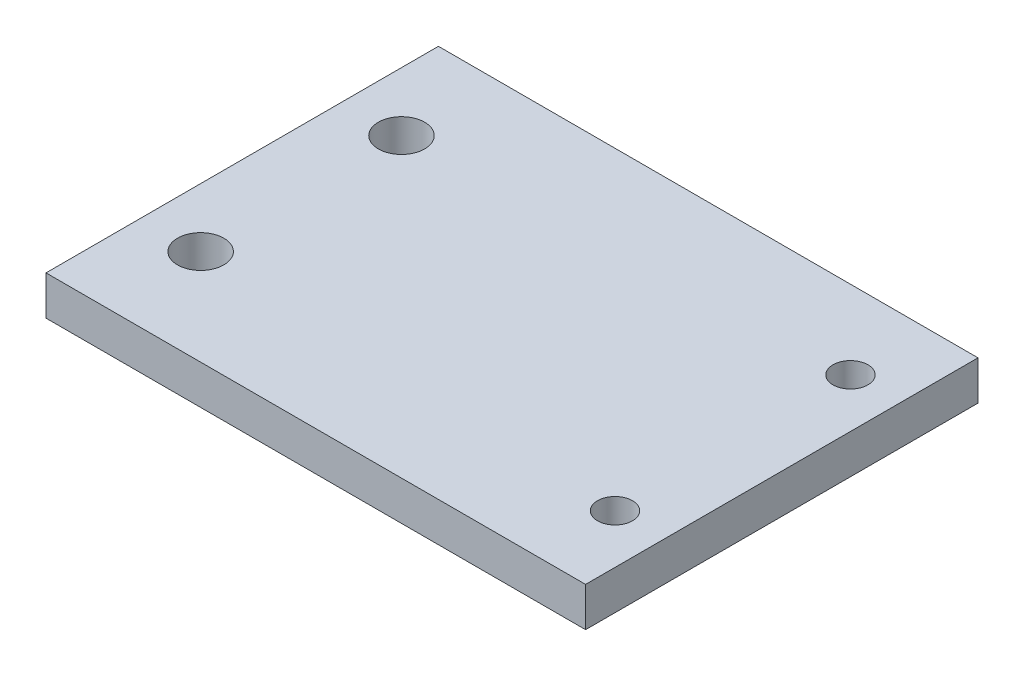
from build123d import *

# Parameters (mm, degrees)
SKETCH1_W               = 34.925
SKETCH1_H               = 25.4
BOSS_EXTRUDE1_DEPTH     = 2.54
CUT_EXTRUDE3_DEPTH      = 44.259302179
CUT_EXTRUDE3_DEPTH_BACK = 44.259302179
SKETCH2_R               = 1.5
SKETCH5_R               = 1.1303
CUT_EXTRUDE4_DEPTH      = 44.259302179


with BuildPart() as part:
    # Sketch1 → Boss-Extrude1 (new body)
    with BuildSketch(Plane(origin=(0, 0, 0), x_dir=(1, 0, 0), z_dir=(0, 1, 0))):
        with Locations((17.4625, 12.7)):
            Rectangle(SKETCH1_W, SKETCH1_H)
    extrude(amount=BOSS_EXTRUDE1_DEPTH)

    # Sketch2 → Cut-Extrude3 (cut, two sides: drawn at the far end of the back side and taken through both)
    with BuildSketch(Plane(origin=(0, 2.54, 0), x_dir=(1, 0, 0), z_dir=(0, 1, 0)).offset(-CUT_EXTRUDE3_DEPTH_BACK)):
        with Locations((3.81, 19.2)):
            Circle(SKETCH2_R)
        with Locations((3.81, 6.2)):
            Circle(SKETCH2_R)
    extrude(amount=CUT_EXTRUDE3_DEPTH + CUT_EXTRUDE3_DEPTH_BACK, mode=Mode.SUBTRACT)

    # Sketch5 → Cut-Extrude4 (cut, through all)
    with BuildSketch(Plane(origin=(0, 2.54, 0), x_dir=(1, 0, 0), z_dir=(0, 1, 0))):
        with Locations((31.75, 20.32)):
            Circle(SKETCH5_R)
        with Locations((31.75, 5.08)):
            Circle(SKETCH5_R)
    extrude(amount=-CUT_EXTRUDE4_DEPTH, mode=Mode.SUBTRACT)


solid = part.part
